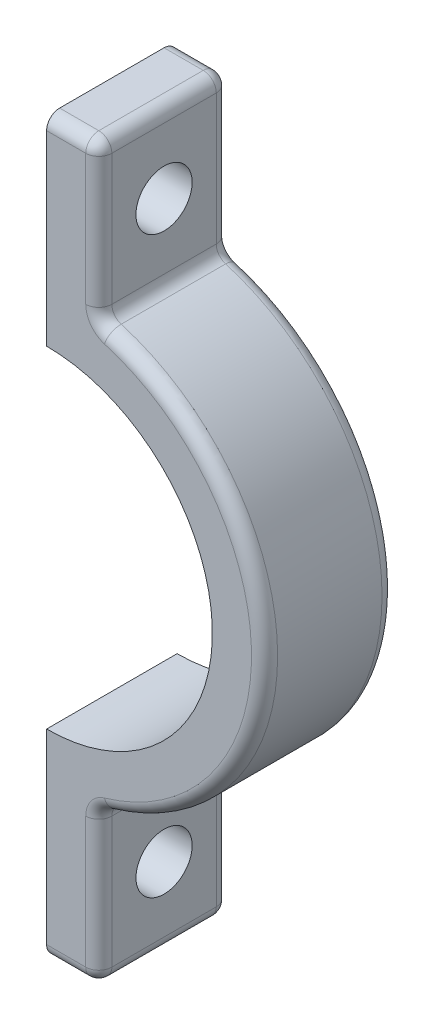
from build123d import *

# Parameters (mm, degrees)
SKETCH1_R                                         = 16.7
SKETCH1_R_2                                       = 12.7
BOSS_EXTRUDE1_DEPTH                               = 10
SKETCH2_W                                         = 22.16607393
SKETCH2_H                                         = 10
SKETCH2_W_2                                       = 4
SKETCH2_H_2                                       = 30
BOSS_EXTRUDE2_DEPTH                               = 10
SKETCH4_W                                         = 8
SKETCH4_H                                         = 11.78611706
BOSS_EXTRUDE3_DEPTH                               = 10
FILLET3_R                                         = 1
CSK_FOR_6_FLAT_HEAD_MACHINE_SCREW_100_D           = 4.3053
CSK_FOR_6_FLAT_HEAD_MACHINE_SCREW_100_CSINK_D     = 7.0866
CSK_FOR_6_FLAT_HEAD_MACHINE_SCREW_100_CSINK_ANGLE = 100
INTERSECT3_START                                  = -42.1
INTERSECT3_OUTLINE_R                              = 2.15265
INTERSECT3_DEPTH                                  = 42.1


# Read off the part's stored shape, not the designer's step: CSK for #4 Flat Head Machine Screw (100)1, Intersect3
with BuildPart() as part:
    # Sketch1 → Boss-Extrude1 (new body)
    with BuildSketch(Plane.XY):
        Circle(SKETCH1_R)
        Circle(SKETCH1_R_2, mode=Mode.SUBTRACT)
    extrude(amount=BOSS_EXTRUDE1_DEPTH)

    # Sketch2 → Boss-Extrude2 (add)
    with BuildSketch(Plane(origin=(0, 0, 0), x_dir=(-1, 0, 0), z_dir=(0, 0, -1))):
        with Locations((27.016963035, 0)):
            Rectangle(SKETCH2_W, SKETCH2_H)
        with Locations((40.1, 0)):
            Rectangle(SKETCH2_W_2, SKETCH2_H_2)
    extrude(amount=-BOSS_EXTRUDE2_DEPTH)

    # Sketch4 → Boss-Extrude3 (add)
    with BuildSketch(Plane(origin=(0, 0, 0), x_dir=(-1, 0, 0), z_dir=(0, 0, -1))):
        with Locations((0, 22.10694147)):
            Rectangle(SKETCH4_W, SKETCH4_H)
    boss_extrude3 = extrude(amount=-BOSS_EXTRUDE3_DEPTH)

    # Mirror1: Boss-Extrude3 across plane
    add(boss_extrude3.mirror(Plane.ZX))

    # Fillet3
    fillet3_edges = [part.edges().sort_by_distance(p)[0] for p in [
        (-11.435827246, -12.170121413, 10),
        (-11.435827246, -12.170121413, 0),
        (-38.1, 10, 10),
        (-40.1, -15, 10),
        (-27.016963035, -5, 10),
        (-38.1, -10, 0),
        (-40.1, 15, 0),
        (-38.1, 10, 0),
        (-27.016963035, 5, 0),
        (-38.1, -10, 10),
        (-40.1, -15, 0),
        (-40.1, 15, 10),
        (-15.93392607, -5, 5),
        (-27.016963035, -5, 0),
        (-27.016963035, 5, 10),
        (-15.93392607, 5, 5),
        (-11.435827246, 12.170121413, 0),
        (-11.435827246, 12.170121413, 10),
        (-4, 22.10694147, 0),
        (0, 28, 0),
        (4, 22.10694147, 0),
        (0, 28, 10),
        (4, 28, 5),
        (4, 22.10694147, 10),
        (4, 16.21388294, 5),
        (-4, 16.21388294, 5),
        (-4, 22.10694147, 10),
        (-4, 28, 5),
        (16.7, 0, 0),
        (16.7, 0, 10),
        (-4, -16.21388294, 5),
        (-4, -22.10694147, 0),
        (-4, -28, 5),
        (0, -28, 0),
        (4, -28, 5),
        (4, -22.10694147, 0),
        (4, -16.21388294, 5),
        (-4, -22.10694147, 10),
        (0, -28, 10),
        (4, -22.10694147, 10),
    ]]
    fillet(fillet3_edges, radius=FILLET3_R)

    # CSK for _4 Flat Head Machine Screw _ 2 → CSK for #4 Flat Head Machine Screw (100)1 (revolve, cut)
    with BuildSketch(Plane(origin=(0, -9, 5), x_dir=(0, 1, 0), z_dir=(0, 0, -1))):
        Polygon((0, -42.1), (1.7272, -42.1), (1.7272, -39.048434313), (2.8575, -38.1), (0, -38.1), align=None)
    csk_for_4_flat_head_machine_screw_100 = revolve(axis=Axis((0, -9, 5), (1, 0, 0)), mode=Mode.SUBTRACT)

    # Mirror2: CSK for #4 Flat Head Machine Screw (100)1 across plane
    add(csk_for_4_flat_head_machine_screw_100.mirror(Plane.ZX), mode=Mode.SUBTRACT)

    # CSK for #6 Flat Head Machine Screw (100)5 (through all)
    with Locations(Plane.ZY.offset(4)):
        with Locations((5, -22)):
            csk_for_6_flat_head_machine_screw_100 = CounterSinkHole(CSK_FOR_6_FLAT_HEAD_MACHINE_SCREW_100_D / 2, CSK_FOR_6_FLAT_HEAD_MACHINE_SCREW_100_CSINK_D / 2, counter_sink_angle=CSK_FOR_6_FLAT_HEAD_MACHINE_SCREW_100_CSINK_ANGLE)

    # Mirror5: CSK for #6 Flat Head Machine Screw (100)5 across plane
    add(csk_for_6_flat_head_machine_screw_100.mirror(Plane.ZX), mode=Mode.SUBTRACT)

    # Intersect3 outline → Intersect3 (cut)
    with BuildSketch(Plane.YZ.offset(INTERSECT3_START)):
        with BuildLine():
            ThreePointArc((28, 9), (27.707106781, 9.707106781), (27, 10))
            Line((27, 10), (-27, 10))
            ThreePointArc((-27, 10), (-27.707106781, 9.707106781), (-28, 9))
            Line((-28, 9), (-28, 1))
            ThreePointArc((-28, 1), (-27.707106781, 0.292893219), (-27, 0))
            Line((-27, 0), (27, 0))
            ThreePointArc((27, 0), (27.707106781, 0.292893219), (28, 1))
            Line((28, 1), (28, 9))
        make_face()
        with Locations((22, 5)):
            Circle(INTERSECT3_OUTLINE_R, mode=Mode.SUBTRACT)
        with Locations((-22, 5)):
            Circle(INTERSECT3_OUTLINE_R, mode=Mode.SUBTRACT)
    extrude(amount=INTERSECT3_DEPTH, mode=Mode.SUBTRACT)


solid = part.part
